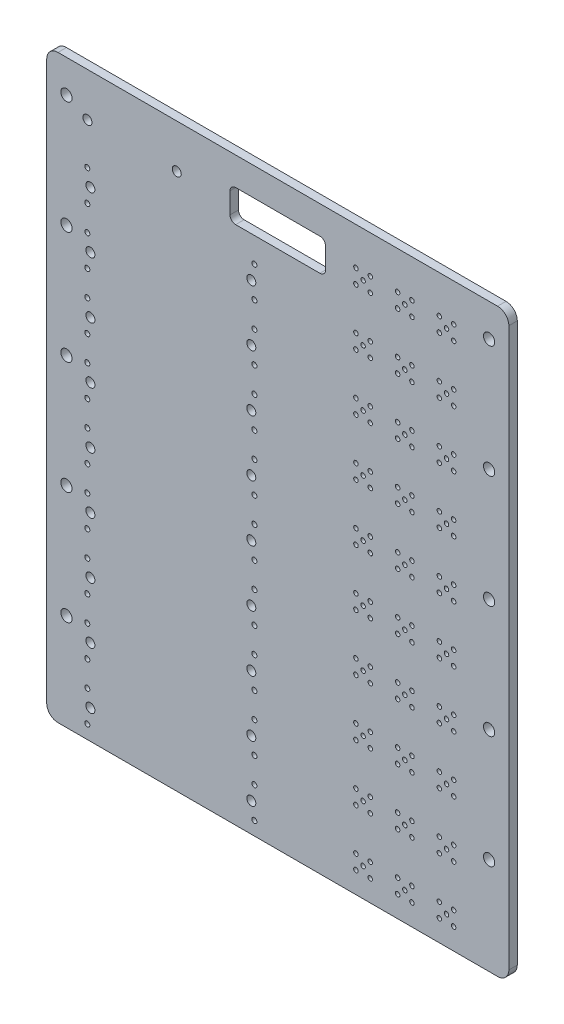
from build123d import *

# Parameters (mm, degrees)
SKETCH2_W                          = 82
SKETCH2_H                          = 103
MAINBOARD_DEPTH                    = 1.5
SKETCH3_W                          = 16.95
SKETCH3_H                          = 5.7
SOLARHOLE_DEPTH                    = 132.663396584
FILLET1_R                          = 2
FILLET2_R                          = 1
F_1_6MM_HOLE_20PIN_D               = 1.6
F_1_6MM_HOLE_20PIN_DEPTH           = 9.525
F_1_6MM_HOLE_20PIN_TIP             = 0.480688495
F_1_6MM_HOLE_40PN_BIG_AT_2_COUNT   = 2
F_1_6MM_HOLE_40PN_BIG_AT_2_PITCH   = 28.55
F_0_8MM_MMCX_HOLE_AT_2_COUNT       = 2
F_0_8MM_MMCX_HOLE_AT_2_PITCH       = 1.796051224
F_0_8MM_MMCX_HOLE_AT_3_COUNT       = 2
F_0_8MM_MMCX_HOLE_AT_3_PITCH       = 1.796051224
F_0_8MM_MMCX_HOLE_AT_4_COUNT       = 2
F_0_8MM_MMCX_HOLE_AT_4_PITCH       = 1.796051224
F_0_8MM_MMCX_HOLE_AT_5_COUNT       = 2
F_0_8MM_MMCX_HOLE_AT_5_PITCH       = 1.796051224
F_0_9MM_HOLE_40PIN_TINY_AT_2_COUNT = 2
F_0_9MM_HOLE_40PIN_TINY_AT_2_PITCH = 5.5
F_0_9MM_HOLE_40PIN_TINY_AT_3_COUNT = 2
F_0_9MM_HOLE_40PIN_TINY_AT_3_PITCH = 29.65
F_0_9MM_HOLE_40PIN_TINY_AT_4_COUNT = 2
F_0_9MM_HOLE_40PIN_TINY_AT_4_PITCH = 30.155803753
MMCX_INTRA_CARD_COUNT              = 3
MMCX_INTRA_CARD_PITCH              = 7.4
ZPOS_BLOCK_COUNT                   = 9
ZPOS_BLOCK_PITCH                   = 10
SCREWHOLES_INTRA_RAIL_COUNT        = 5
SCREWHOLES_INTRA_RAIL_PITCH        = 20


with BuildPart() as part:
    # Sketch2 → mainBoard (new body)
    with BuildSketch(Plane.XY):
        with Locations((41, 51.5)):
            Rectangle(SKETCH2_W, SKETCH2_H)
    extrude(amount=MAINBOARD_DEPTH)

    # Sketch3 → solarHole (cut, through all)
    with BuildSketch(Plane.XY.offset(1.5)):
        with Locations((41, 95.15)):
            Rectangle(SKETCH3_W, SKETCH3_H)
    extrude(amount=-SOLARHOLE_DEPTH, mode=Mode.SUBTRACT)

    # Fillet1
    fillet1_edges = [part.edges().sort_by_distance(p)[0] for p in [
        (0, 0, 0.75),
        (82, 0, 0.75),
        (82, 103, 0.75),
        (0, 103, 0.75),
    ]]
    fillet(fillet1_edges, radius=FILLET1_R)

    # Fillet2
    fillet2_edges = [part.edges().sort_by_distance(p)[0] for p in [
        (49.475, 92.3, 0.75),
        (49.475, 98, 0.75),
        (32.525, 92.3, 0.75),
        (32.525, 98, 0.75),
    ]]
    fillet(fillet2_edges, radius=FILLET2_R)

    # Sketch5 → Ø2.0mm Hole_screw (revolve, cut)
    with BuildSketch(Plane(origin=(3.5, 97.2, 1.5), x_dir=(0, -1, 0), z_dir=(1, 0, 0))):
        Polygon((0, 0), (0, 10.125860619), (1, 9.525), (1, 0), align=None)
    f_2_0mm_hole_screw = revolve(axis=Axis((3.5, 97.2, 7.85), (0, 0, -1)), mode=Mode.SUBTRACT)

    # Ø1.6mm Hole_20pin
    with Locations(Plane.XY.offset(1.5)):
        with Locations((7.225, 95.25), (23.075, 95.25)):
            Hole(F_1_6MM_HOLE_20PIN_D / 2, depth=F_1_6MM_HOLE_20PIN_DEPTH)
            with Locations((0, 0, -(F_1_6MM_HOLE_20PIN_DEPTH + F_1_6MM_HOLE_20PIN_TIP / 2))):  # 118° drill point
                Cone(0, F_1_6MM_HOLE_20PIN_D / 2, F_1_6MM_HOLE_20PIN_TIP, mode=Mode.SUBTRACT)

    # Sketch7 → Ø1.6mm Hole_40pn_big (revolve, cut)
    with BuildSketch(Plane(origin=(7.75, 85.15, 1.5), x_dir=(0, -1, 0), z_dir=(1, 0, 0))):
        Polygon((0, 0), (0, 10.005688495), (0.8, 9.525), (0.8, 0), align=None)
    f_1_6mm_hole_40pn_big = revolve(axis=Axis((7.75, 85.15, 7.85), (0, 0, -1)), mode=Mode.SUBTRACT)

    # Ø1.6mm Hole_40pn_big at 2: Ø1.6mm Hole_40pn_big ×2
    with Locations(*[(i * F_1_6MM_HOLE_40PN_BIG_AT_2_PITCH, 0, 0) for i in range(1, F_1_6MM_HOLE_40PN_BIG_AT_2_COUNT)]):
        add(f_1_6mm_hole_40pn_big, mode=Mode.SUBTRACT)

    # Sketch9 → Ø0.8mm MMCX Hole (revolve, cut)
    with BuildSketch(Plane(origin=(70.94, 85.05, 1.5), x_dir=(0, -1, 0), z_dir=(1, 0, 0))):
        Polygon((0, 0), (0, 9.765344248), (0.4, 9.525), (0.4, 0), align=None)
    f_0_8mm_mmcx_hole = revolve(axis=Axis((70.94, 85.05, 7.85), (0, 0, -1)), mode=Mode.SUBTRACT)

    # Ø0.8mm MMCX Hole at 2: Ø0.8mm MMCX Hole ×2
    with Locations(*[Vector(-0.7071067811865436, 0.7071067811865515, 0) * (i * F_0_8MM_MMCX_HOLE_AT_2_PITCH) for i in range(1, F_0_8MM_MMCX_HOLE_AT_2_COUNT)]):
        add(f_0_8mm_mmcx_hole, mode=Mode.SUBTRACT)

    # Ø0.8mm MMCX Hole at 3: Ø0.8mm MMCX Hole ×2
    with Locations(*[Vector(0.7071067811865476, 0.7071067811865476, 0) * (i * F_0_8MM_MMCX_HOLE_AT_3_PITCH) for i in range(1, F_0_8MM_MMCX_HOLE_AT_3_COUNT)]):
        add(f_0_8mm_mmcx_hole, mode=Mode.SUBTRACT)

    # Ø0.8mm MMCX Hole at 4: Ø0.8mm MMCX Hole ×2
    with Locations(*[Vector(0.7071067811865515, -0.7071067811865436, 0) * (i * F_0_8MM_MMCX_HOLE_AT_4_PITCH) for i in range(1, F_0_8MM_MMCX_HOLE_AT_4_COUNT)]):
        add(f_0_8mm_mmcx_hole, mode=Mode.SUBTRACT)

    # Ø0.8mm MMCX Hole at 5: Ø0.8mm MMCX Hole ×2
    with Locations(*[Vector(-0.7071067811865476, -0.7071067811865476, 0) * (i * F_0_8MM_MMCX_HOLE_AT_5_PITCH) for i in range(1, F_0_8MM_MMCX_HOLE_AT_5_COUNT)]):
        add(f_0_8mm_mmcx_hole, mode=Mode.SUBTRACT)

    # Sketch11 → Ø0.9mm Hole_40pin_tiny (revolve, cut)
    with BuildSketch(Plane(origin=(7.2, 87.9, 1.5), x_dir=(0, -1, 0), z_dir=(1, 0, 0))):
        Polygon((0, 0), (0, 9.795387279), (0.45, 9.525), (0.45, 0), align=None)
    f_0_9mm_hole_40pin_tiny = revolve(axis=Axis((7.2, 87.9, 7.85), (0, 0, -1)), mode=Mode.SUBTRACT)

    # Ø0.9mm Hole_40pin_tiny at 2: Ø0.9mm Hole_40pin_tiny ×2
    with Locations(*[(0, -i * F_0_9MM_HOLE_40PIN_TINY_AT_2_PITCH, 0) for i in range(1, F_0_9MM_HOLE_40PIN_TINY_AT_2_COUNT)]):
        add(f_0_9mm_hole_40pin_tiny, mode=Mode.SUBTRACT)

    # Ø0.9mm Hole_40pin_tiny at 3: Ø0.9mm Hole_40pin_tiny ×2
    with Locations(*[(i * F_0_9MM_HOLE_40PIN_TINY_AT_3_PITCH, 0, 0) for i in range(1, F_0_9MM_HOLE_40PIN_TINY_AT_3_COUNT)]):
        add(f_0_9mm_hole_40pin_tiny, mode=Mode.SUBTRACT)

    # Ø0.9mm Hole_40pin_tiny at 4: Ø0.9mm Hole_40pin_tiny ×2
    with Locations(*[Vector(0.9832269848512432, -0.18238611860646992, 0) * (i * F_0_9MM_HOLE_40PIN_TINY_AT_4_PITCH) for i in range(1, F_0_9MM_HOLE_40PIN_TINY_AT_4_COUNT)]):
        add(f_0_9mm_hole_40pin_tiny, mode=Mode.SUBTRACT)

    # MMCX_intra-card: Ø0.8mm MMCX Hole ×3
    with Locations(*[(-i * MMCX_INTRA_CARD_PITCH, 0, 0) for i in range(1, MMCX_INTRA_CARD_COUNT)]):
        add(f_0_8mm_mmcx_hole, mode=Mode.SUBTRACT)

    # MMCX_intra-card copy 1 sketch → MMCX_intra-card copy 1 (revolve, cut)
    with BuildSketch(Plane(origin=(62.27, 86.32, 1.5), x_dir=(0, -1, 0), z_dir=(1, 0, 0))):
        Polygon((0, 0), (0, 9.765344248), (0.4, 9.525), (0.4, 0), align=None)
    revolve(axis=Axis((62.27, 86.32, 7.85), (0, 0, -1)), mode=Mode.SUBTRACT)

    # MMCX_intra-card copy 2 sketch → MMCX_intra-card copy 2 (revolve, cut)
    with BuildSketch(Plane(origin=(54.87, 86.32, 1.5), x_dir=(0, -1, 0), z_dir=(1, 0, 0))):
        Polygon((0, 0), (0, 9.765344248), (0.4, 9.525), (0.4, 0), align=None)
    revolve(axis=Axis((54.87, 86.32, 7.85), (0, 0, -1)), mode=Mode.SUBTRACT)

    # MMCX_intra-card copy 3 sketch → MMCX_intra-card copy 3 (revolve, cut)
    with BuildSketch(Plane(origin=(64.81, 86.32, 1.5), x_dir=(0, -1, 0), z_dir=(1, 0, 0))):
        Polygon((0, 0), (0, 9.765344248), (0.4, 9.525), (0.4, 0), align=None)
    revolve(axis=Axis((64.81, 86.32, 7.85), (0, 0, -1)), mode=Mode.SUBTRACT)

    # MMCX_intra-card copy 4 sketch → MMCX_intra-card copy 4 (revolve, cut)
    with BuildSketch(Plane(origin=(57.41, 86.32, 1.5), x_dir=(0, -1, 0), z_dir=(1, 0, 0))):
        Polygon((0, 0), (0, 9.765344248), (0.4, 9.525), (0.4, 0), align=None)
    revolve(axis=Axis((57.41, 86.32, 7.85), (0, 0, -1)), mode=Mode.SUBTRACT)

    # MMCX_intra-card copy 5 sketch → MMCX_intra-card copy 5 (revolve, cut)
    with BuildSketch(Plane(origin=(64.81, 83.78, 1.5), x_dir=(0, -1, 0), z_dir=(1, 0, 0))):
        Polygon((0, 0), (0, 9.765344248), (0.4, 9.525), (0.4, 0), align=None)
    revolve(axis=Axis((64.81, 83.78, 7.85), (0, 0, -1)), mode=Mode.SUBTRACT)

    # MMCX_intra-card copy 6 sketch → MMCX_intra-card copy 6 (revolve, cut)
    with BuildSketch(Plane(origin=(57.41, 83.78, 1.5), x_dir=(0, -1, 0), z_dir=(1, 0, 0))):
        Polygon((0, 0), (0, 9.765344248), (0.4, 9.525), (0.4, 0), align=None)
    revolve(axis=Axis((57.41, 83.78, 7.85), (0, 0, -1)), mode=Mode.SUBTRACT)

    # MMCX_intra-card copy 7 sketch → MMCX_intra-card copy 7 (revolve, cut)
    with BuildSketch(Plane(origin=(62.27, 83.78, 1.5), x_dir=(0, -1, 0), z_dir=(1, 0, 0))):
        Polygon((0, 0), (0, 9.765344248), (0.4, 9.525), (0.4, 0), align=None)
    revolve(axis=Axis((62.27, 83.78, 7.85), (0, 0, -1)), mode=Mode.SUBTRACT)

    # MMCX_intra-card copy 8 sketch → MMCX_intra-card copy 8 (revolve, cut)
    with BuildSketch(Plane(origin=(54.87, 83.78, 1.5), x_dir=(0, -1, 0), z_dir=(1, 0, 0))):
        Polygon((0, 0), (0, 9.765344248), (0.4, 9.525), (0.4, 0), align=None)
    revolve(axis=Axis((54.87, 83.78, 7.85), (0, 0, -1)), mode=Mode.SUBTRACT)

    # Zpos_block: Ø1.6mm Hole_40pn_big, Ø0.9mm Hole_40pin_tiny ×9
    with Locations(*[(0, -i * ZPOS_BLOCK_PITCH, 0) for i in range(1, ZPOS_BLOCK_COUNT)]):
        add(f_1_6mm_hole_40pn_big, mode=Mode.SUBTRACT)
        add(f_0_9mm_hole_40pin_tiny, mode=Mode.SUBTRACT)

    # Zpos_block copy 1 sketch → Zpos_block copy 1 (revolve, cut)
    with BuildSketch(Plane(origin=(36.3, 75.15, 1.5), x_dir=(0, -1, 0), z_dir=(1, 0, 0))):
        Polygon((0, 0), (0, 10.005688495), (0.8, 9.525), (0.8, 0), align=None)
    revolve(axis=Axis((36.3, 75.15, 7.85), (0, 0, -1)), mode=Mode.SUBTRACT)

    # Zpos_block copy 2 sketch → Zpos_block copy 2 (revolve, cut)
    with BuildSketch(Plane(origin=(36.3, 65.15, 1.5), x_dir=(0, -1, 0), z_dir=(1, 0, 0))):
        Polygon((0, 0), (0, 10.005688495), (0.8, 9.525), (0.8, 0), align=None)
    revolve(axis=Axis((36.3, 65.15, 7.85), (0, 0, -1)), mode=Mode.SUBTRACT)

    # Zpos_block copy 3 sketch → Zpos_block copy 3 (revolve, cut)
    with BuildSketch(Plane(origin=(36.3, 55.15, 1.5), x_dir=(0, -1, 0), z_dir=(1, 0, 0))):
        Polygon((0, 0), (0, 10.005688495), (0.8, 9.525), (0.8, 0), align=None)
    revolve(axis=Axis((36.3, 55.15, 7.85), (0, 0, -1)), mode=Mode.SUBTRACT)

    # Zpos_block copy 4 sketch → Zpos_block copy 4 (revolve, cut)
    with BuildSketch(Plane(origin=(36.3, 45.15, 1.5), x_dir=(0, -1, 0), z_dir=(1, 0, 0))):
        Polygon((0, 0), (0, 10.005688495), (0.8, 9.525), (0.8, 0), align=None)
    revolve(axis=Axis((36.3, 45.15, 7.85), (0, 0, -1)), mode=Mode.SUBTRACT)

    # Zpos_block copy 5 sketch → Zpos_block copy 5 (revolve, cut)
    with BuildSketch(Plane(origin=(36.3, 35.15, 1.5), x_dir=(0, -1, 0), z_dir=(1, 0, 0))):
        Polygon((0, 0), (0, 10.005688495), (0.8, 9.525), (0.8, 0), align=None)
    revolve(axis=Axis((36.3, 35.15, 7.85), (0, 0, -1)), mode=Mode.SUBTRACT)

    # Zpos_block copy 6 sketch → Zpos_block copy 6 (revolve, cut)
    with BuildSketch(Plane(origin=(36.3, 25.15, 1.5), x_dir=(0, -1, 0), z_dir=(1, 0, 0))):
        Polygon((0, 0), (0, 10.005688495), (0.8, 9.525), (0.8, 0), align=None)
    revolve(axis=Axis((36.3, 25.15, 7.85), (0, 0, -1)), mode=Mode.SUBTRACT)

    # Zpos_block copy 7 sketch → Zpos_block copy 7 (revolve, cut)
    with BuildSketch(Plane(origin=(36.3, 15.15, 1.5), x_dir=(0, -1, 0), z_dir=(1, 0, 0))):
        Polygon((0, 0), (0, 10.005688495), (0.8, 9.525), (0.8, 0), align=None)
    revolve(axis=Axis((36.3, 15.15, 7.85), (0, 0, -1)), mode=Mode.SUBTRACT)

    # Zpos_block copy 8 sketch → Zpos_block copy 8 (revolve, cut)
    with BuildSketch(Plane(origin=(36.3, 5.15, 1.5), x_dir=(0, -1, 0), z_dir=(1, 0, 0))):
        Polygon((0, 0), (0, 10.005688495), (0.8, 9.525), (0.8, 0), align=None)
    revolve(axis=Axis((36.3, 5.15, 7.85), (0, 0, -1)), mode=Mode.SUBTRACT)

    # Zpos_block copy 9 sketch → Zpos_block copy 9 (revolve, cut)
    with BuildSketch(Plane(origin=(7.2, 72.4, 1.5), x_dir=(0, -1, 0), z_dir=(1, 0, 0))):
        Polygon((0, 0), (0, 9.795387279), (0.45, 9.525), (0.45, 0), align=None)
    revolve(axis=Axis((7.2, 72.4, 7.85), (0, 0, -1)), mode=Mode.SUBTRACT)

    # Zpos_block copy 10 sketch → Zpos_block copy 10 (revolve, cut)
    with BuildSketch(Plane(origin=(7.2, 62.4, 1.5), x_dir=(0, -1, 0), z_dir=(1, 0, 0))):
        Polygon((0, 0), (0, 9.795387279), (0.45, 9.525), (0.45, 0), align=None)
    revolve(axis=Axis((7.2, 62.4, 7.85), (0, 0, -1)), mode=Mode.SUBTRACT)

    # Zpos_block copy 11 sketch → Zpos_block copy 11 (revolve, cut)
    with BuildSketch(Plane(origin=(7.2, 52.4, 1.5), x_dir=(0, -1, 0), z_dir=(1, 0, 0))):
        Polygon((0, 0), (0, 9.795387279), (0.45, 9.525), (0.45, 0), align=None)
    revolve(axis=Axis((7.2, 52.4, 7.85), (0, 0, -1)), mode=Mode.SUBTRACT)

    # Zpos_block copy 12 sketch → Zpos_block copy 12 (revolve, cut)
    with BuildSketch(Plane(origin=(7.2, 42.4, 1.5), x_dir=(0, -1, 0), z_dir=(1, 0, 0))):
        Polygon((0, 0), (0, 9.795387279), (0.45, 9.525), (0.45, 0), align=None)
    revolve(axis=Axis((7.2, 42.4, 7.85), (0, 0, -1)), mode=Mode.SUBTRACT)

    # Zpos_block copy 13 sketch → Zpos_block copy 13 (revolve, cut)
    with BuildSketch(Plane(origin=(7.2, 32.4, 1.5), x_dir=(0, -1, 0), z_dir=(1, 0, 0))):
        Polygon((0, 0), (0, 9.795387279), (0.45, 9.525), (0.45, 0), align=None)
    revolve(axis=Axis((7.2, 32.4, 7.85), (0, 0, -1)), mode=Mode.SUBTRACT)

    # Zpos_block copy 14 sketch → Zpos_block copy 14 (revolve, cut)
    with BuildSketch(Plane(origin=(7.2, 22.4, 1.5), x_dir=(0, -1, 0), z_dir=(1, 0, 0))):
        Polygon((0, 0), (0, 9.795387279), (0.45, 9.525), (0.45, 0), align=None)
    revolve(axis=Axis((7.2, 22.4, 7.85), (0, 0, -1)), mode=Mode.SUBTRACT)

    # Zpos_block copy 15 sketch → Zpos_block copy 15 (revolve, cut)
    with BuildSketch(Plane(origin=(7.2, 12.4, 1.5), x_dir=(0, -1, 0), z_dir=(1, 0, 0))):
        Polygon((0, 0), (0, 9.795387279), (0.45, 9.525), (0.45, 0), align=None)
    revolve(axis=Axis((7.2, 12.4, 7.85), (0, 0, -1)), mode=Mode.SUBTRACT)

    # Zpos_block copy 16 sketch → Zpos_block copy 16 (revolve, cut)
    with BuildSketch(Plane(origin=(7.2, 2.4, 1.5), x_dir=(0, -1, 0), z_dir=(1, 0, 0))):
        Polygon((0, 0), (0, 9.795387279), (0.45, 9.525), (0.45, 0), align=None)
    revolve(axis=Axis((7.2, 2.4, 7.85), (0, 0, -1)), mode=Mode.SUBTRACT)

    # Zpos_block copy 17 sketch → Zpos_block copy 17 (revolve, cut)
    with BuildSketch(Plane(origin=(36.85, 77.9, 1.5), x_dir=(0, -1, 0), z_dir=(1, 0, 0))):
        Polygon((0, 0), (0, 9.795387279), (0.45, 9.525), (0.45, 0), align=None)
    revolve(axis=Axis((36.85, 77.9, 7.85), (0, 0, -1)), mode=Mode.SUBTRACT)

    # Zpos_block copy 18 sketch → Zpos_block copy 18 (revolve, cut)
    with BuildSketch(Plane(origin=(36.85, 67.9, 1.5), x_dir=(0, -1, 0), z_dir=(1, 0, 0))):
        Polygon((0, 0), (0, 9.795387279), (0.45, 9.525), (0.45, 0), align=None)
    revolve(axis=Axis((36.85, 67.9, 7.85), (0, 0, -1)), mode=Mode.SUBTRACT)

    # Zpos_block copy 19 sketch → Zpos_block copy 19 (revolve, cut)
    with BuildSketch(Plane(origin=(36.85, 57.9, 1.5), x_dir=(0, -1, 0), z_dir=(1, 0, 0))):
        Polygon((0, 0), (0, 9.795387279), (0.45, 9.525), (0.45, 0), align=None)
    revolve(axis=Axis((36.85, 57.9, 7.85), (0, 0, -1)), mode=Mode.SUBTRACT)

    # Zpos_block copy 20 sketch → Zpos_block copy 20 (revolve, cut)
    with BuildSketch(Plane(origin=(36.85, 47.9, 1.5), x_dir=(0, -1, 0), z_dir=(1, 0, 0))):
        Polygon((0, 0), (0, 9.795387279), (0.45, 9.525), (0.45, 0), align=None)
    revolve(axis=Axis((36.85, 47.9, 7.85), (0, 0, -1)), mode=Mode.SUBTRACT)

    # Zpos_block copy 21 sketch → Zpos_block copy 21 (revolve, cut)
    with BuildSketch(Plane(origin=(36.85, 37.9, 1.5), x_dir=(0, -1, 0), z_dir=(1, 0, 0))):
        Polygon((0, 0), (0, 9.795387279), (0.45, 9.525), (0.45, 0), align=None)
    revolve(axis=Axis((36.85, 37.9, 7.85), (0, 0, -1)), mode=Mode.SUBTRACT)

    # Zpos_block copy 22 sketch → Zpos_block copy 22 (revolve, cut)
    with BuildSketch(Plane(origin=(36.85, 27.9, 1.5), x_dir=(0, -1, 0), z_dir=(1, 0, 0))):
        Polygon((0, 0), (0, 9.795387279), (0.45, 9.525), (0.45, 0), align=None)
    revolve(axis=Axis((36.85, 27.9, 7.85), (0, 0, -1)), mode=Mode.SUBTRACT)

    # Zpos_block copy 23 sketch → Zpos_block copy 23 (revolve, cut)
    with BuildSketch(Plane(origin=(36.85, 17.9, 1.5), x_dir=(0, -1, 0), z_dir=(1, 0, 0))):
        Polygon((0, 0), (0, 9.795387279), (0.45, 9.525), (0.45, 0), align=None)
    revolve(axis=Axis((36.85, 17.9, 7.85), (0, 0, -1)), mode=Mode.SUBTRACT)

    # Zpos_block copy 24 sketch → Zpos_block copy 24 (revolve, cut)
    with BuildSketch(Plane(origin=(36.85, 7.9, 1.5), x_dir=(0, -1, 0), z_dir=(1, 0, 0))):
        Polygon((0, 0), (0, 9.795387279), (0.45, 9.525), (0.45, 0), align=None)
    revolve(axis=Axis((36.85, 7.9, 7.85), (0, 0, -1)), mode=Mode.SUBTRACT)

    # Zpos_block copy 25 sketch → Zpos_block copy 25 (revolve, cut)
    with BuildSketch(Plane(origin=(36.85, 72.4, 1.5), x_dir=(0, -1, 0), z_dir=(1, 0, 0))):
        Polygon((0, 0), (0, 9.795387279), (0.45, 9.525), (0.45, 0), align=None)
    revolve(axis=Axis((36.85, 72.4, 7.85), (0, 0, -1)), mode=Mode.SUBTRACT)

    # Zpos_block copy 26 sketch → Zpos_block copy 26 (revolve, cut)
    with BuildSketch(Plane(origin=(36.85, 62.4, 1.5), x_dir=(0, -1, 0), z_dir=(1, 0, 0))):
        Polygon((0, 0), (0, 9.795387279), (0.45, 9.525), (0.45, 0), align=None)
    revolve(axis=Axis((36.85, 62.4, 7.85), (0, 0, -1)), mode=Mode.SUBTRACT)

    # Zpos_block copy 27 sketch → Zpos_block copy 27 (revolve, cut)
    with BuildSketch(Plane(origin=(36.85, 52.4, 1.5), x_dir=(0, -1, 0), z_dir=(1, 0, 0))):
        Polygon((0, 0), (0, 9.795387279), (0.45, 9.525), (0.45, 0), align=None)
    revolve(axis=Axis((36.85, 52.4, 7.85), (0, 0, -1)), mode=Mode.SUBTRACT)

    # Zpos_block copy 28 sketch → Zpos_block copy 28 (revolve, cut)
    with BuildSketch(Plane(origin=(36.85, 42.4, 1.5), x_dir=(0, -1, 0), z_dir=(1, 0, 0))):
        Polygon((0, 0), (0, 9.795387279), (0.45, 9.525), (0.45, 0), align=None)
    revolve(axis=Axis((36.85, 42.4, 7.85), (0, 0, -1)), mode=Mode.SUBTRACT)

    # Zpos_block copy 29 sketch → Zpos_block copy 29 (revolve, cut)
    with BuildSketch(Plane(origin=(36.85, 32.4, 1.5), x_dir=(0, -1, 0), z_dir=(1, 0, 0))):
        Polygon((0, 0), (0, 9.795387279), (0.45, 9.525), (0.45, 0), align=None)
    revolve(axis=Axis((36.85, 32.4, 7.85), (0, 0, -1)), mode=Mode.SUBTRACT)

    # Zpos_block copy 30 sketch → Zpos_block copy 30 (revolve, cut)
    with BuildSketch(Plane(origin=(36.85, 22.4, 1.5), x_dir=(0, -1, 0), z_dir=(1, 0, 0))):
        Polygon((0, 0), (0, 9.795387279), (0.45, 9.525), (0.45, 0), align=None)
    revolve(axis=Axis((36.85, 22.4, 7.85), (0, 0, -1)), mode=Mode.SUBTRACT)

    # Zpos_block copy 31 sketch → Zpos_block copy 31 (revolve, cut)
    with BuildSketch(Plane(origin=(36.85, 12.4, 1.5), x_dir=(0, -1, 0), z_dir=(1, 0, 0))):
        Polygon((0, 0), (0, 9.795387279), (0.45, 9.525), (0.45, 0), align=None)
    revolve(axis=Axis((36.85, 12.4, 7.85), (0, 0, -1)), mode=Mode.SUBTRACT)

    # Zpos_block copy 32 sketch → Zpos_block copy 32 (revolve, cut)
    with BuildSketch(Plane(origin=(36.85, 2.4, 1.5), x_dir=(0, -1, 0), z_dir=(1, 0, 0))):
        Polygon((0, 0), (0, 9.795387279), (0.45, 9.525), (0.45, 0), align=None)
    revolve(axis=Axis((36.85, 2.4, 7.85), (0, 0, -1)), mode=Mode.SUBTRACT)

    # Zpos_block copy 33 sketch → Zpos_block copy 33 (revolve, cut)
    with BuildSketch(Plane(origin=(63.54, 75.05, 1.5), x_dir=(0, -1, 0), z_dir=(1, 0, 0))):
        Polygon((0, 0), (0, 9.765344248), (0.4, 9.525), (0.4, 0), align=None)
    revolve(axis=Axis((63.54, 75.05, 7.85), (0, 0, -1)), mode=Mode.SUBTRACT)

    # Zpos_block copy 34 sketch → Zpos_block copy 34 (revolve, cut)
    with BuildSketch(Plane(origin=(63.54, 65.05, 1.5), x_dir=(0, -1, 0), z_dir=(1, 0, 0))):
        Polygon((0, 0), (0, 9.765344248), (0.4, 9.525), (0.4, 0), align=None)
    revolve(axis=Axis((63.54, 65.05, 7.85), (0, 0, -1)), mode=Mode.SUBTRACT)

    # Zpos_block copy 35 sketch → Zpos_block copy 35 (revolve, cut)
    with BuildSketch(Plane(origin=(63.54, 55.05, 1.5), x_dir=(0, -1, 0), z_dir=(1, 0, 0))):
        Polygon((0, 0), (0, 9.765344248), (0.4, 9.525), (0.4, 0), align=None)
    revolve(axis=Axis((63.54, 55.05, 7.85), (0, 0, -1)), mode=Mode.SUBTRACT)

    # Zpos_block copy 36 sketch → Zpos_block copy 36 (revolve, cut)
    with BuildSketch(Plane(origin=(63.54, 45.05, 1.5), x_dir=(0, -1, 0), z_dir=(1, 0, 0))):
        Polygon((0, 0), (0, 9.765344248), (0.4, 9.525), (0.4, 0), align=None)
    revolve(axis=Axis((63.54, 45.05, 7.85), (0, 0, -1)), mode=Mode.SUBTRACT)

    # Zpos_block copy 37 sketch → Zpos_block copy 37 (revolve, cut)
    with BuildSketch(Plane(origin=(63.54, 35.05, 1.5), x_dir=(0, -1, 0), z_dir=(1, 0, 0))):
        Polygon((0, 0), (0, 9.765344248), (0.4, 9.525), (0.4, 0), align=None)
    revolve(axis=Axis((63.54, 35.05, 7.85), (0, 0, -1)), mode=Mode.SUBTRACT)

    # Zpos_block copy 38 sketch → Zpos_block copy 38 (revolve, cut)
    with BuildSketch(Plane(origin=(63.54, 25.05, 1.5), x_dir=(0, -1, 0), z_dir=(1, 0, 0))):
        Polygon((0, 0), (0, 9.765344248), (0.4, 9.525), (0.4, 0), align=None)
    revolve(axis=Axis((63.54, 25.05, 7.85), (0, 0, -1)), mode=Mode.SUBTRACT)

    # Zpos_block copy 39 sketch → Zpos_block copy 39 (revolve, cut)
    with BuildSketch(Plane(origin=(63.54, 15.05, 1.5), x_dir=(0, -1, 0), z_dir=(1, 0, 0))):
        Polygon((0, 0), (0, 9.765344248), (0.4, 9.525), (0.4, 0), align=None)
    revolve(axis=Axis((63.54, 15.05, 7.85), (0, 0, -1)), mode=Mode.SUBTRACT)

    # Zpos_block copy 40 sketch → Zpos_block copy 40 (revolve, cut)
    with BuildSketch(Plane(origin=(63.54, 5.05, 1.5), x_dir=(0, -1, 0), z_dir=(1, 0, 0))):
        Polygon((0, 0), (0, 9.765344248), (0.4, 9.525), (0.4, 0), align=None)
    revolve(axis=Axis((63.54, 5.05, 7.85), (0, 0, -1)), mode=Mode.SUBTRACT)

    # Zpos_block copy 41 sketch → Zpos_block copy 41 (revolve, cut)
    with BuildSketch(Plane(origin=(56.14, 75.05, 1.5), x_dir=(0, -1, 0), z_dir=(1, 0, 0))):
        Polygon((0, 0), (0, 9.765344248), (0.4, 9.525), (0.4, 0), align=None)
    revolve(axis=Axis((56.14, 75.05, 7.85), (0, 0, -1)), mode=Mode.SUBTRACT)

    # Zpos_block copy 42 sketch → Zpos_block copy 42 (revolve, cut)
    with BuildSketch(Plane(origin=(56.14, 65.05, 1.5), x_dir=(0, -1, 0), z_dir=(1, 0, 0))):
        Polygon((0, 0), (0, 9.765344248), (0.4, 9.525), (0.4, 0), align=None)
    revolve(axis=Axis((56.14, 65.05, 7.85), (0, 0, -1)), mode=Mode.SUBTRACT)

    # Zpos_block copy 43 sketch → Zpos_block copy 43 (revolve, cut)
    with BuildSketch(Plane(origin=(56.14, 55.05, 1.5), x_dir=(0, -1, 0), z_dir=(1, 0, 0))):
        Polygon((0, 0), (0, 9.765344248), (0.4, 9.525), (0.4, 0), align=None)
    revolve(axis=Axis((56.14, 55.05, 7.85), (0, 0, -1)), mode=Mode.SUBTRACT)

    # Zpos_block copy 44 sketch → Zpos_block copy 44 (revolve, cut)
    with BuildSketch(Plane(origin=(56.14, 45.05, 1.5), x_dir=(0, -1, 0), z_dir=(1, 0, 0))):
        Polygon((0, 0), (0, 9.765344248), (0.4, 9.525), (0.4, 0), align=None)
    revolve(axis=Axis((56.14, 45.05, 7.85), (0, 0, -1)), mode=Mode.SUBTRACT)

    # Zpos_block copy 45 sketch → Zpos_block copy 45 (revolve, cut)
    with BuildSketch(Plane(origin=(56.14, 35.05, 1.5), x_dir=(0, -1, 0), z_dir=(1, 0, 0))):
        Polygon((0, 0), (0, 9.765344248), (0.4, 9.525), (0.4, 0), align=None)
    revolve(axis=Axis((56.14, 35.05, 7.85), (0, 0, -1)), mode=Mode.SUBTRACT)

    # Zpos_block copy 46 sketch → Zpos_block copy 46 (revolve, cut)
    with BuildSketch(Plane(origin=(56.14, 25.05, 1.5), x_dir=(0, -1, 0), z_dir=(1, 0, 0))):
        Polygon((0, 0), (0, 9.765344248), (0.4, 9.525), (0.4, 0), align=None)
    revolve(axis=Axis((56.14, 25.05, 7.85), (0, 0, -1)), mode=Mode.SUBTRACT)

    # Zpos_block copy 47 sketch → Zpos_block copy 47 (revolve, cut)
    with BuildSketch(Plane(origin=(56.14, 15.05, 1.5), x_dir=(0, -1, 0), z_dir=(1, 0, 0))):
        Polygon((0, 0), (0, 9.765344248), (0.4, 9.525), (0.4, 0), align=None)
    revolve(axis=Axis((56.14, 15.05, 7.85), (0, 0, -1)), mode=Mode.SUBTRACT)

    # Zpos_block copy 48 sketch → Zpos_block copy 48 (revolve, cut)
    with BuildSketch(Plane(origin=(56.14, 5.05, 1.5), x_dir=(0, -1, 0), z_dir=(1, 0, 0))):
        Polygon((0, 0), (0, 9.765344248), (0.4, 9.525), (0.4, 0), align=None)
    revolve(axis=Axis((56.14, 5.05, 7.85), (0, 0, -1)), mode=Mode.SUBTRACT)

    # Zpos_block copy 49 sketch → Zpos_block copy 49 (revolve, cut)
    with BuildSketch(Plane(origin=(62.27, 76.32, 1.5), x_dir=(0, -1, 0), z_dir=(1, 0, 0))):
        Polygon((0, 0), (0, 9.765344248), (0.4, 9.525), (0.4, 0), align=None)
    revolve(axis=Axis((62.27, 76.32, 7.85), (0, 0, -1)), mode=Mode.SUBTRACT)

    # Zpos_block copy 50 sketch → Zpos_block copy 50 (revolve, cut)
    with BuildSketch(Plane(origin=(62.27, 66.32, 1.5), x_dir=(0, -1, 0), z_dir=(1, 0, 0))):
        Polygon((0, 0), (0, 9.765344248), (0.4, 9.525), (0.4, 0), align=None)
    revolve(axis=Axis((62.27, 66.32, 7.85), (0, 0, -1)), mode=Mode.SUBTRACT)

    # Zpos_block copy 51 sketch → Zpos_block copy 51 (revolve, cut)
    with BuildSketch(Plane(origin=(62.27, 56.32, 1.5), x_dir=(0, -1, 0), z_dir=(1, 0, 0))):
        Polygon((0, 0), (0, 9.765344248), (0.4, 9.525), (0.4, 0), align=None)
    revolve(axis=Axis((62.27, 56.32, 7.85), (0, 0, -1)), mode=Mode.SUBTRACT)

    # Zpos_block copy 52 sketch → Zpos_block copy 52 (revolve, cut)
    with BuildSketch(Plane(origin=(62.27, 46.32, 1.5), x_dir=(0, -1, 0), z_dir=(1, 0, 0))):
        Polygon((0, 0), (0, 9.765344248), (0.4, 9.525), (0.4, 0), align=None)
    revolve(axis=Axis((62.27, 46.32, 7.85), (0, 0, -1)), mode=Mode.SUBTRACT)

    # Zpos_block copy 53 sketch → Zpos_block copy 53 (revolve, cut)
    with BuildSketch(Plane(origin=(62.27, 36.32, 1.5), x_dir=(0, -1, 0), z_dir=(1, 0, 0))):
        Polygon((0, 0), (0, 9.765344248), (0.4, 9.525), (0.4, 0), align=None)
    revolve(axis=Axis((62.27, 36.32, 7.85), (0, 0, -1)), mode=Mode.SUBTRACT)

    # Zpos_block copy 54 sketch → Zpos_block copy 54 (revolve, cut)
    with BuildSketch(Plane(origin=(62.27, 26.32, 1.5), x_dir=(0, -1, 0), z_dir=(1, 0, 0))):
        Polygon((0, 0), (0, 9.765344248), (0.4, 9.525), (0.4, 0), align=None)
    revolve(axis=Axis((62.27, 26.32, 7.85), (0, 0, -1)), mode=Mode.SUBTRACT)

    # Zpos_block copy 55 sketch → Zpos_block copy 55 (revolve, cut)
    with BuildSketch(Plane(origin=(62.27, 16.32, 1.5), x_dir=(0, -1, 0), z_dir=(1, 0, 0))):
        Polygon((0, 0), (0, 9.765344248), (0.4, 9.525), (0.4, 0), align=None)
    revolve(axis=Axis((62.27, 16.32, 7.85), (0, 0, -1)), mode=Mode.SUBTRACT)

    # Zpos_block copy 56 sketch → Zpos_block copy 56 (revolve, cut)
    with BuildSketch(Plane(origin=(62.27, 6.32, 1.5), x_dir=(0, -1, 0), z_dir=(1, 0, 0))):
        Polygon((0, 0), (0, 9.765344248), (0.4, 9.525), (0.4, 0), align=None)
    revolve(axis=Axis((62.27, 6.32, 7.85), (0, 0, -1)), mode=Mode.SUBTRACT)

    # Zpos_block copy 57 sketch → Zpos_block copy 57 (revolve, cut)
    with BuildSketch(Plane(origin=(54.87, 76.32, 1.5), x_dir=(0, -1, 0), z_dir=(1, 0, 0))):
        Polygon((0, 0), (0, 9.765344248), (0.4, 9.525), (0.4, 0), align=None)
    revolve(axis=Axis((54.87, 76.32, 7.85), (0, 0, -1)), mode=Mode.SUBTRACT)

    # Zpos_block copy 58 sketch → Zpos_block copy 58 (revolve, cut)
    with BuildSketch(Plane(origin=(54.87, 66.32, 1.5), x_dir=(0, -1, 0), z_dir=(1, 0, 0))):
        Polygon((0, 0), (0, 9.765344248), (0.4, 9.525), (0.4, 0), align=None)
    revolve(axis=Axis((54.87, 66.32, 7.85), (0, 0, -1)), mode=Mode.SUBTRACT)

    # Zpos_block copy 59 sketch → Zpos_block copy 59 (revolve, cut)
    with BuildSketch(Plane(origin=(54.87, 56.32, 1.5), x_dir=(0, -1, 0), z_dir=(1, 0, 0))):
        Polygon((0, 0), (0, 9.765344248), (0.4, 9.525), (0.4, 0), align=None)
    revolve(axis=Axis((54.87, 56.32, 7.85), (0, 0, -1)), mode=Mode.SUBTRACT)

    # Zpos_block copy 60 sketch → Zpos_block copy 60 (revolve, cut)
    with BuildSketch(Plane(origin=(54.87, 46.32, 1.5), x_dir=(0, -1, 0), z_dir=(1, 0, 0))):
        Polygon((0, 0), (0, 9.765344248), (0.4, 9.525), (0.4, 0), align=None)
    revolve(axis=Axis((54.87, 46.32, 7.85), (0, 0, -1)), mode=Mode.SUBTRACT)

    # Zpos_block copy 61 sketch → Zpos_block copy 61 (revolve, cut)
    with BuildSketch(Plane(origin=(54.87, 36.32, 1.5), x_dir=(0, -1, 0), z_dir=(1, 0, 0))):
        Polygon((0, 0), (0, 9.765344248), (0.4, 9.525), (0.4, 0), align=None)
    revolve(axis=Axis((54.87, 36.32, 7.85), (0, 0, -1)), mode=Mode.SUBTRACT)

    # Zpos_block copy 62 sketch → Zpos_block copy 62 (revolve, cut)
    with BuildSketch(Plane(origin=(54.87, 26.32, 1.5), x_dir=(0, -1, 0), z_dir=(1, 0, 0))):
        Polygon((0, 0), (0, 9.765344248), (0.4, 9.525), (0.4, 0), align=None)
    revolve(axis=Axis((54.87, 26.32, 7.85), (0, 0, -1)), mode=Mode.SUBTRACT)

    # Zpos_block copy 63 sketch → Zpos_block copy 63 (revolve, cut)
    with BuildSketch(Plane(origin=(54.87, 16.32, 1.5), x_dir=(0, -1, 0), z_dir=(1, 0, 0))):
        Polygon((0, 0), (0, 9.765344248), (0.4, 9.525), (0.4, 0), align=None)
    revolve(axis=Axis((54.87, 16.32, 7.85), (0, 0, -1)), mode=Mode.SUBTRACT)

    # Zpos_block copy 64 sketch → Zpos_block copy 64 (revolve, cut)
    with BuildSketch(Plane(origin=(54.87, 6.32, 1.5), x_dir=(0, -1, 0), z_dir=(1, 0, 0))):
        Polygon((0, 0), (0, 9.765344248), (0.4, 9.525), (0.4, 0), align=None)
    revolve(axis=Axis((54.87, 6.32, 7.85), (0, 0, -1)), mode=Mode.SUBTRACT)

    # Zpos_block copy 65 sketch → Zpos_block copy 65 (revolve, cut)
    with BuildSketch(Plane(origin=(64.81, 76.32, 1.5), x_dir=(0, -1, 0), z_dir=(1, 0, 0))):
        Polygon((0, 0), (0, 9.765344248), (0.4, 9.525), (0.4, 0), align=None)
    revolve(axis=Axis((64.81, 76.32, 7.85), (0, 0, -1)), mode=Mode.SUBTRACT)

    # Zpos_block copy 66 sketch → Zpos_block copy 66 (revolve, cut)
    with BuildSketch(Plane(origin=(64.81, 66.32, 1.5), x_dir=(0, -1, 0), z_dir=(1, 0, 0))):
        Polygon((0, 0), (0, 9.765344248), (0.4, 9.525), (0.4, 0), align=None)
    revolve(axis=Axis((64.81, 66.32, 7.85), (0, 0, -1)), mode=Mode.SUBTRACT)

    # Zpos_block copy 67 sketch → Zpos_block copy 67 (revolve, cut)
    with BuildSketch(Plane(origin=(64.81, 56.32, 1.5), x_dir=(0, -1, 0), z_dir=(1, 0, 0))):
        Polygon((0, 0), (0, 9.765344248), (0.4, 9.525), (0.4, 0), align=None)
    revolve(axis=Axis((64.81, 56.32, 7.85), (0, 0, -1)), mode=Mode.SUBTRACT)

    # Zpos_block copy 68 sketch → Zpos_block copy 68 (revolve, cut)
    with BuildSketch(Plane(origin=(64.81, 46.32, 1.5), x_dir=(0, -1, 0), z_dir=(1, 0, 0))):
        Polygon((0, 0), (0, 9.765344248), (0.4, 9.525), (0.4, 0), align=None)
    revolve(axis=Axis((64.81, 46.32, 7.85), (0, 0, -1)), mode=Mode.SUBTRACT)

    # Zpos_block copy 69 sketch → Zpos_block copy 69 (revolve, cut)
    with BuildSketch(Plane(origin=(64.81, 36.32, 1.5), x_dir=(0, -1, 0), z_dir=(1, 0, 0))):
        Polygon((0, 0), (0, 9.765344248), (0.4, 9.525), (0.4, 0), align=None)
    revolve(axis=Axis((64.81, 36.32, 7.85), (0, 0, -1)), mode=Mode.SUBTRACT)

    # Zpos_block copy 70 sketch → Zpos_block copy 70 (revolve, cut)
    with BuildSketch(Plane(origin=(64.81, 26.32, 1.5), x_dir=(0, -1, 0), z_dir=(1, 0, 0))):
        Polygon((0, 0), (0, 9.765344248), (0.4, 9.525), (0.4, 0), align=None)
    revolve(axis=Axis((64.81, 26.32, 7.85), (0, 0, -1)), mode=Mode.SUBTRACT)

    # Zpos_block copy 71 sketch → Zpos_block copy 71 (revolve, cut)
    with BuildSketch(Plane(origin=(64.81, 16.32, 1.5), x_dir=(0, -1, 0), z_dir=(1, 0, 0))):
        Polygon((0, 0), (0, 9.765344248), (0.4, 9.525), (0.4, 0), align=None)
    revolve(axis=Axis((64.81, 16.32, 7.85), (0, 0, -1)), mode=Mode.SUBTRACT)

    # Zpos_block copy 72 sketch → Zpos_block copy 72 (revolve, cut)
    with BuildSketch(Plane(origin=(64.81, 6.32, 1.5), x_dir=(0, -1, 0), z_dir=(1, 0, 0))):
        Polygon((0, 0), (0, 9.765344248), (0.4, 9.525), (0.4, 0), align=None)
    revolve(axis=Axis((64.81, 6.32, 7.85), (0, 0, -1)), mode=Mode.SUBTRACT)

    # Zpos_block copy 73 sketch → Zpos_block copy 73 (revolve, cut)
    with BuildSketch(Plane(origin=(57.41, 76.32, 1.5), x_dir=(0, -1, 0), z_dir=(1, 0, 0))):
        Polygon((0, 0), (0, 9.765344248), (0.4, 9.525), (0.4, 0), align=None)
    revolve(axis=Axis((57.41, 76.32, 7.85), (0, 0, -1)), mode=Mode.SUBTRACT)

    # Zpos_block copy 74 sketch → Zpos_block copy 74 (revolve, cut)
    with BuildSketch(Plane(origin=(57.41, 66.32, 1.5), x_dir=(0, -1, 0), z_dir=(1, 0, 0))):
        Polygon((0, 0), (0, 9.765344248), (0.4, 9.525), (0.4, 0), align=None)
    revolve(axis=Axis((57.41, 66.32, 7.85), (0, 0, -1)), mode=Mode.SUBTRACT)

    # Zpos_block copy 75 sketch → Zpos_block copy 75 (revolve, cut)
    with BuildSketch(Plane(origin=(57.41, 56.32, 1.5), x_dir=(0, -1, 0), z_dir=(1, 0, 0))):
        Polygon((0, 0), (0, 9.765344248), (0.4, 9.525), (0.4, 0), align=None)
    revolve(axis=Axis((57.41, 56.32, 7.85), (0, 0, -1)), mode=Mode.SUBTRACT)

    # Zpos_block copy 76 sketch → Zpos_block copy 76 (revolve, cut)
    with BuildSketch(Plane(origin=(57.41, 46.32, 1.5), x_dir=(0, -1, 0), z_dir=(1, 0, 0))):
        Polygon((0, 0), (0, 9.765344248), (0.4, 9.525), (0.4, 0), align=None)
    revolve(axis=Axis((57.41, 46.32, 7.85), (0, 0, -1)), mode=Mode.SUBTRACT)

    # Zpos_block copy 77 sketch → Zpos_block copy 77 (revolve, cut)
    with BuildSketch(Plane(origin=(57.41, 36.32, 1.5), x_dir=(0, -1, 0), z_dir=(1, 0, 0))):
        Polygon((0, 0), (0, 9.765344248), (0.4, 9.525), (0.4, 0), align=None)
    revolve(axis=Axis((57.41, 36.32, 7.85), (0, 0, -1)), mode=Mode.SUBTRACT)

    # Zpos_block copy 78 sketch → Zpos_block copy 78 (revolve, cut)
    with BuildSketch(Plane(origin=(57.41, 26.32, 1.5), x_dir=(0, -1, 0), z_dir=(1, 0, 0))):
        Polygon((0, 0), (0, 9.765344248), (0.4, 9.525), (0.4, 0), align=None)
    revolve(axis=Axis((57.41, 26.32, 7.85), (0, 0, -1)), mode=Mode.SUBTRACT)

    # Zpos_block copy 79 sketch → Zpos_block copy 79 (revolve, cut)
    with BuildSketch(Plane(origin=(57.41, 16.32, 1.5), x_dir=(0, -1, 0), z_dir=(1, 0, 0))):
        Polygon((0, 0), (0, 9.765344248), (0.4, 9.525), (0.4, 0), align=None)
    revolve(axis=Axis((57.41, 16.32, 7.85), (0, 0, -1)), mode=Mode.SUBTRACT)

    # Zpos_block copy 80 sketch → Zpos_block copy 80 (revolve, cut)
    with BuildSketch(Plane(origin=(57.41, 6.32, 1.5), x_dir=(0, -1, 0), z_dir=(1, 0, 0))):
        Polygon((0, 0), (0, 9.765344248), (0.4, 9.525), (0.4, 0), align=None)
    revolve(axis=Axis((57.41, 6.32, 7.85), (0, 0, -1)), mode=Mode.SUBTRACT)

    # Zpos_block copy 81 sketch → Zpos_block copy 81 (revolve, cut)
    with BuildSketch(Plane(origin=(64.81, 73.78, 1.5), x_dir=(0, -1, 0), z_dir=(1, 0, 0))):
        Polygon((0, 0), (0, 9.765344248), (0.4, 9.525), (0.4, 0), align=None)
    revolve(axis=Axis((64.81, 73.78, 7.85), (0, 0, -1)), mode=Mode.SUBTRACT)

    # Zpos_block copy 82 sketch → Zpos_block copy 82 (revolve, cut)
    with BuildSketch(Plane(origin=(64.81, 63.78, 1.5), x_dir=(0, -1, 0), z_dir=(1, 0, 0))):
        Polygon((0, 0), (0, 9.765344248), (0.4, 9.525), (0.4, 0), align=None)
    revolve(axis=Axis((64.81, 63.78, 7.85), (0, 0, -1)), mode=Mode.SUBTRACT)

    # Zpos_block copy 83 sketch → Zpos_block copy 83 (revolve, cut)
    with BuildSketch(Plane(origin=(64.81, 53.78, 1.5), x_dir=(0, -1, 0), z_dir=(1, 0, 0))):
        Polygon((0, 0), (0, 9.765344248), (0.4, 9.525), (0.4, 0), align=None)
    revolve(axis=Axis((64.81, 53.78, 7.85), (0, 0, -1)), mode=Mode.SUBTRACT)

    # Zpos_block copy 84 sketch → Zpos_block copy 84 (revolve, cut)
    with BuildSketch(Plane(origin=(64.81, 43.78, 1.5), x_dir=(0, -1, 0), z_dir=(1, 0, 0))):
        Polygon((0, 0), (0, 9.765344248), (0.4, 9.525), (0.4, 0), align=None)
    revolve(axis=Axis((64.81, 43.78, 7.85), (0, 0, -1)), mode=Mode.SUBTRACT)

    # Zpos_block copy 85 sketch → Zpos_block copy 85 (revolve, cut)
    with BuildSketch(Plane(origin=(64.81, 33.78, 1.5), x_dir=(0, -1, 0), z_dir=(1, 0, 0))):
        Polygon((0, 0), (0, 9.765344248), (0.4, 9.525), (0.4, 0), align=None)
    revolve(axis=Axis((64.81, 33.78, 7.85), (0, 0, -1)), mode=Mode.SUBTRACT)

    # Zpos_block copy 86 sketch → Zpos_block copy 86 (revolve, cut)
    with BuildSketch(Plane(origin=(64.81, 23.78, 1.5), x_dir=(0, -1, 0), z_dir=(1, 0, 0))):
        Polygon((0, 0), (0, 9.765344248), (0.4, 9.525), (0.4, 0), align=None)
    revolve(axis=Axis((64.81, 23.78, 7.85), (0, 0, -1)), mode=Mode.SUBTRACT)

    # Zpos_block copy 87 sketch → Zpos_block copy 87 (revolve, cut)
    with BuildSketch(Plane(origin=(64.81, 13.78, 1.5), x_dir=(0, -1, 0), z_dir=(1, 0, 0))):
        Polygon((0, 0), (0, 9.765344248), (0.4, 9.525), (0.4, 0), align=None)
    revolve(axis=Axis((64.81, 13.78, 7.85), (0, 0, -1)), mode=Mode.SUBTRACT)

    # Zpos_block copy 88 sketch → Zpos_block copy 88 (revolve, cut)
    with BuildSketch(Plane(origin=(64.81, 3.78, 1.5), x_dir=(0, -1, 0), z_dir=(1, 0, 0))):
        Polygon((0, 0), (0, 9.765344248), (0.4, 9.525), (0.4, 0), align=None)
    revolve(axis=Axis((64.81, 3.78, 7.85), (0, 0, -1)), mode=Mode.SUBTRACT)

    # Zpos_block copy 89 sketch → Zpos_block copy 89 (revolve, cut)
    with BuildSketch(Plane(origin=(57.41, 73.78, 1.5), x_dir=(0, -1, 0), z_dir=(1, 0, 0))):
        Polygon((0, 0), (0, 9.765344248), (0.4, 9.525), (0.4, 0), align=None)
    revolve(axis=Axis((57.41, 73.78, 7.85), (0, 0, -1)), mode=Mode.SUBTRACT)

    # Zpos_block copy 90 sketch → Zpos_block copy 90 (revolve, cut)
    with BuildSketch(Plane(origin=(57.41, 63.78, 1.5), x_dir=(0, -1, 0), z_dir=(1, 0, 0))):
        Polygon((0, 0), (0, 9.765344248), (0.4, 9.525), (0.4, 0), align=None)
    revolve(axis=Axis((57.41, 63.78, 7.85), (0, 0, -1)), mode=Mode.SUBTRACT)

    # Zpos_block copy 91 sketch → Zpos_block copy 91 (revolve, cut)
    with BuildSketch(Plane(origin=(57.41, 53.78, 1.5), x_dir=(0, -1, 0), z_dir=(1, 0, 0))):
        Polygon((0, 0), (0, 9.765344248), (0.4, 9.525), (0.4, 0), align=None)
    revolve(axis=Axis((57.41, 53.78, 7.85), (0, 0, -1)), mode=Mode.SUBTRACT)

    # Zpos_block copy 92 sketch → Zpos_block copy 92 (revolve, cut)
    with BuildSketch(Plane(origin=(57.41, 43.78, 1.5), x_dir=(0, -1, 0), z_dir=(1, 0, 0))):
        Polygon((0, 0), (0, 9.765344248), (0.4, 9.525), (0.4, 0), align=None)
    revolve(axis=Axis((57.41, 43.78, 7.85), (0, 0, -1)), mode=Mode.SUBTRACT)

    # Zpos_block copy 93 sketch → Zpos_block copy 93 (revolve, cut)
    with BuildSketch(Plane(origin=(57.41, 33.78, 1.5), x_dir=(0, -1, 0), z_dir=(1, 0, 0))):
        Polygon((0, 0), (0, 9.765344248), (0.4, 9.525), (0.4, 0), align=None)
    revolve(axis=Axis((57.41, 33.78, 7.85), (0, 0, -1)), mode=Mode.SUBTRACT)

    # Zpos_block copy 94 sketch → Zpos_block copy 94 (revolve, cut)
    with BuildSketch(Plane(origin=(57.41, 23.78, 1.5), x_dir=(0, -1, 0), z_dir=(1, 0, 0))):
        Polygon((0, 0), (0, 9.765344248), (0.4, 9.525), (0.4, 0), align=None)
    revolve(axis=Axis((57.41, 23.78, 7.85), (0, 0, -1)), mode=Mode.SUBTRACT)

    # Zpos_block copy 95 sketch → Zpos_block copy 95 (revolve, cut)
    with BuildSketch(Plane(origin=(57.41, 13.78, 1.5), x_dir=(0, -1, 0), z_dir=(1, 0, 0))):
        Polygon((0, 0), (0, 9.765344248), (0.4, 9.525), (0.4, 0), align=None)
    revolve(axis=Axis((57.41, 13.78, 7.85), (0, 0, -1)), mode=Mode.SUBTRACT)

    # Zpos_block copy 96 sketch → Zpos_block copy 96 (revolve, cut)
    with BuildSketch(Plane(origin=(57.41, 3.78, 1.5), x_dir=(0, -1, 0), z_dir=(1, 0, 0))):
        Polygon((0, 0), (0, 9.765344248), (0.4, 9.525), (0.4, 0), align=None)
    revolve(axis=Axis((57.41, 3.78, 7.85), (0, 0, -1)), mode=Mode.SUBTRACT)

    # Zpos_block copy 97 sketch → Zpos_block copy 97 (revolve, cut)
    with BuildSketch(Plane(origin=(62.27, 73.78, 1.5), x_dir=(0, -1, 0), z_dir=(1, 0, 0))):
        Polygon((0, 0), (0, 9.765344248), (0.4, 9.525), (0.4, 0), align=None)
    revolve(axis=Axis((62.27, 73.78, 7.85), (0, 0, -1)), mode=Mode.SUBTRACT)

    # Zpos_block copy 98 sketch → Zpos_block copy 98 (revolve, cut)
    with BuildSketch(Plane(origin=(62.27, 63.78, 1.5), x_dir=(0, -1, 0), z_dir=(1, 0, 0))):
        Polygon((0, 0), (0, 9.765344248), (0.4, 9.525), (0.4, 0), align=None)
    revolve(axis=Axis((62.27, 63.78, 7.85), (0, 0, -1)), mode=Mode.SUBTRACT)

    # Zpos_block copy 99 sketch → Zpos_block copy 99 (revolve, cut)
    with BuildSketch(Plane(origin=(62.27, 53.78, 1.5), x_dir=(0, -1, 0), z_dir=(1, 0, 0))):
        Polygon((0, 0), (0, 9.765344248), (0.4, 9.525), (0.4, 0), align=None)
    revolve(axis=Axis((62.27, 53.78, 7.85), (0, 0, -1)), mode=Mode.SUBTRACT)

    # Zpos_block copy 100 sketch → Zpos_block copy 100 (revolve, cut)
    with BuildSketch(Plane(origin=(62.27, 43.78, 1.5), x_dir=(0, -1, 0), z_dir=(1, 0, 0))):
        Polygon((0, 0), (0, 9.765344248), (0.4, 9.525), (0.4, 0), align=None)
    revolve(axis=Axis((62.27, 43.78, 7.85), (0, 0, -1)), mode=Mode.SUBTRACT)

    # Zpos_block copy 101 sketch → Zpos_block copy 101 (revolve, cut)
    with BuildSketch(Plane(origin=(62.27, 33.78, 1.5), x_dir=(0, -1, 0), z_dir=(1, 0, 0))):
        Polygon((0, 0), (0, 9.765344248), (0.4, 9.525), (0.4, 0), align=None)
    revolve(axis=Axis((62.27, 33.78, 7.85), (0, 0, -1)), mode=Mode.SUBTRACT)

    # Zpos_block copy 102 sketch → Zpos_block copy 102 (revolve, cut)
    with BuildSketch(Plane(origin=(62.27, 23.78, 1.5), x_dir=(0, -1, 0), z_dir=(1, 0, 0))):
        Polygon((0, 0), (0, 9.765344248), (0.4, 9.525), (0.4, 0), align=None)
    revolve(axis=Axis((62.27, 23.78, 7.85), (0, 0, -1)), mode=Mode.SUBTRACT)

    # Zpos_block copy 103 sketch → Zpos_block copy 103 (revolve, cut)
    with BuildSketch(Plane(origin=(62.27, 13.78, 1.5), x_dir=(0, -1, 0), z_dir=(1, 0, 0))):
        Polygon((0, 0), (0, 9.765344248), (0.4, 9.525), (0.4, 0), align=None)
    revolve(axis=Axis((62.27, 13.78, 7.85), (0, 0, -1)), mode=Mode.SUBTRACT)

    # Zpos_block copy 104 sketch → Zpos_block copy 104 (revolve, cut)
    with BuildSketch(Plane(origin=(62.27, 3.78, 1.5), x_dir=(0, -1, 0), z_dir=(1, 0, 0))):
        Polygon((0, 0), (0, 9.765344248), (0.4, 9.525), (0.4, 0), align=None)
    revolve(axis=Axis((62.27, 3.78, 7.85), (0, 0, -1)), mode=Mode.SUBTRACT)

    # Zpos_block copy 105 sketch → Zpos_block copy 105 (revolve, cut)
    with BuildSketch(Plane(origin=(54.87, 73.78, 1.5), x_dir=(0, -1, 0), z_dir=(1, 0, 0))):
        Polygon((0, 0), (0, 9.765344248), (0.4, 9.525), (0.4, 0), align=None)
    revolve(axis=Axis((54.87, 73.78, 7.85), (0, 0, -1)), mode=Mode.SUBTRACT)

    # Zpos_block copy 106 sketch → Zpos_block copy 106 (revolve, cut)
    with BuildSketch(Plane(origin=(54.87, 63.78, 1.5), x_dir=(0, -1, 0), z_dir=(1, 0, 0))):
        Polygon((0, 0), (0, 9.765344248), (0.4, 9.525), (0.4, 0), align=None)
    revolve(axis=Axis((54.87, 63.78, 7.85), (0, 0, -1)), mode=Mode.SUBTRACT)

    # Zpos_block copy 107 sketch → Zpos_block copy 107 (revolve, cut)
    with BuildSketch(Plane(origin=(54.87, 53.78, 1.5), x_dir=(0, -1, 0), z_dir=(1, 0, 0))):
        Polygon((0, 0), (0, 9.765344248), (0.4, 9.525), (0.4, 0), align=None)
    revolve(axis=Axis((54.87, 53.78, 7.85), (0, 0, -1)), mode=Mode.SUBTRACT)

    # Zpos_block copy 108 sketch → Zpos_block copy 108 (revolve, cut)
    with BuildSketch(Plane(origin=(54.87, 43.78, 1.5), x_dir=(0, -1, 0), z_dir=(1, 0, 0))):
        Polygon((0, 0), (0, 9.765344248), (0.4, 9.525), (0.4, 0), align=None)
    revolve(axis=Axis((54.87, 43.78, 7.85), (0, 0, -1)), mode=Mode.SUBTRACT)

    # Zpos_block copy 109 sketch → Zpos_block copy 109 (revolve, cut)
    with BuildSketch(Plane(origin=(54.87, 33.78, 1.5), x_dir=(0, -1, 0), z_dir=(1, 0, 0))):
        Polygon((0, 0), (0, 9.765344248), (0.4, 9.525), (0.4, 0), align=None)
    revolve(axis=Axis((54.87, 33.78, 7.85), (0, 0, -1)), mode=Mode.SUBTRACT)

    # Zpos_block copy 110 sketch → Zpos_block copy 110 (revolve, cut)
    with BuildSketch(Plane(origin=(54.87, 23.78, 1.5), x_dir=(0, -1, 0), z_dir=(1, 0, 0))):
        Polygon((0, 0), (0, 9.765344248), (0.4, 9.525), (0.4, 0), align=None)
    revolve(axis=Axis((54.87, 23.78, 7.85), (0, 0, -1)), mode=Mode.SUBTRACT)

    # Zpos_block copy 111 sketch → Zpos_block copy 111 (revolve, cut)
    with BuildSketch(Plane(origin=(54.87, 13.78, 1.5), x_dir=(0, -1, 0), z_dir=(1, 0, 0))):
        Polygon((0, 0), (0, 9.765344248), (0.4, 9.525), (0.4, 0), align=None)
    revolve(axis=Axis((54.87, 13.78, 7.85), (0, 0, -1)), mode=Mode.SUBTRACT)

    # Zpos_block copy 112 sketch → Zpos_block copy 112 (revolve, cut)
    with BuildSketch(Plane(origin=(54.87, 3.78, 1.5), x_dir=(0, -1, 0), z_dir=(1, 0, 0))):
        Polygon((0, 0), (0, 9.765344248), (0.4, 9.525), (0.4, 0), align=None)
    revolve(axis=Axis((54.87, 3.78, 7.85), (0, 0, -1)), mode=Mode.SUBTRACT)

    # Zpos_block copy 113 sketch → Zpos_block copy 113 (revolve, cut)
    with BuildSketch(Plane(origin=(70.94, 75.05, 1.5), x_dir=(0, -1, 0), z_dir=(1, 0, 0))):
        Polygon((0, 0), (0, 9.765344248), (0.4, 9.525), (0.4, 0), align=None)
    revolve(axis=Axis((70.94, 75.05, 7.85), (0, 0, -1)), mode=Mode.SUBTRACT)

    # Zpos_block copy 114 sketch → Zpos_block copy 114 (revolve, cut)
    with BuildSketch(Plane(origin=(70.94, 65.05, 1.5), x_dir=(0, -1, 0), z_dir=(1, 0, 0))):
        Polygon((0, 0), (0, 9.765344248), (0.4, 9.525), (0.4, 0), align=None)
    revolve(axis=Axis((70.94, 65.05, 7.85), (0, 0, -1)), mode=Mode.SUBTRACT)

    # Zpos_block copy 115 sketch → Zpos_block copy 115 (revolve, cut)
    with BuildSketch(Plane(origin=(70.94, 55.05, 1.5), x_dir=(0, -1, 0), z_dir=(1, 0, 0))):
        Polygon((0, 0), (0, 9.765344248), (0.4, 9.525), (0.4, 0), align=None)
    revolve(axis=Axis((70.94, 55.05, 7.85), (0, 0, -1)), mode=Mode.SUBTRACT)

    # Zpos_block copy 116 sketch → Zpos_block copy 116 (revolve, cut)
    with BuildSketch(Plane(origin=(70.94, 45.05, 1.5), x_dir=(0, -1, 0), z_dir=(1, 0, 0))):
        Polygon((0, 0), (0, 9.765344248), (0.4, 9.525), (0.4, 0), align=None)
    revolve(axis=Axis((70.94, 45.05, 7.85), (0, 0, -1)), mode=Mode.SUBTRACT)

    # Zpos_block copy 117 sketch → Zpos_block copy 117 (revolve, cut)
    with BuildSketch(Plane(origin=(70.94, 35.05, 1.5), x_dir=(0, -1, 0), z_dir=(1, 0, 0))):
        Polygon((0, 0), (0, 9.765344248), (0.4, 9.525), (0.4, 0), align=None)
    revolve(axis=Axis((70.94, 35.05, 7.85), (0, 0, -1)), mode=Mode.SUBTRACT)

    # Zpos_block copy 118 sketch → Zpos_block copy 118 (revolve, cut)
    with BuildSketch(Plane(origin=(70.94, 25.05, 1.5), x_dir=(0, -1, 0), z_dir=(1, 0, 0))):
        Polygon((0, 0), (0, 9.765344248), (0.4, 9.525), (0.4, 0), align=None)
    revolve(axis=Axis((70.94, 25.05, 7.85), (0, 0, -1)), mode=Mode.SUBTRACT)

    # Zpos_block copy 119 sketch → Zpos_block copy 119 (revolve, cut)
    with BuildSketch(Plane(origin=(70.94, 15.05, 1.5), x_dir=(0, -1, 0), z_dir=(1, 0, 0))):
        Polygon((0, 0), (0, 9.765344248), (0.4, 9.525), (0.4, 0), align=None)
    revolve(axis=Axis((70.94, 15.05, 7.85), (0, 0, -1)), mode=Mode.SUBTRACT)

    # Zpos_block copy 120 sketch → Zpos_block copy 120 (revolve, cut)
    with BuildSketch(Plane(origin=(70.94, 5.05, 1.5), x_dir=(0, -1, 0), z_dir=(1, 0, 0))):
        Polygon((0, 0), (0, 9.765344248), (0.4, 9.525), (0.4, 0), align=None)
    revolve(axis=Axis((70.94, 5.05, 7.85), (0, 0, -1)), mode=Mode.SUBTRACT)

    # Zpos_block copy 121 sketch → Zpos_block copy 121 (revolve, cut)
    with BuildSketch(Plane(origin=(69.67, 76.32, 1.5), x_dir=(0, -1, 0), z_dir=(1, 0, 0))):
        Polygon((0, 0), (0, 9.765344248), (0.4, 9.525), (0.4, 0), align=None)
    revolve(axis=Axis((69.67, 76.32, 7.85), (0, 0, -1)), mode=Mode.SUBTRACT)

    # Zpos_block copy 122 sketch → Zpos_block copy 122 (revolve, cut)
    with BuildSketch(Plane(origin=(69.67, 66.32, 1.5), x_dir=(0, -1, 0), z_dir=(1, 0, 0))):
        Polygon((0, 0), (0, 9.765344248), (0.4, 9.525), (0.4, 0), align=None)
    revolve(axis=Axis((69.67, 66.32, 7.85), (0, 0, -1)), mode=Mode.SUBTRACT)

    # Zpos_block copy 123 sketch → Zpos_block copy 123 (revolve, cut)
    with BuildSketch(Plane(origin=(69.67, 56.32, 1.5), x_dir=(0, -1, 0), z_dir=(1, 0, 0))):
        Polygon((0, 0), (0, 9.765344248), (0.4, 9.525), (0.4, 0), align=None)
    revolve(axis=Axis((69.67, 56.32, 7.85), (0, 0, -1)), mode=Mode.SUBTRACT)

    # Zpos_block copy 124 sketch → Zpos_block copy 124 (revolve, cut)
    with BuildSketch(Plane(origin=(69.67, 46.32, 1.5), x_dir=(0, -1, 0), z_dir=(1, 0, 0))):
        Polygon((0, 0), (0, 9.765344248), (0.4, 9.525), (0.4, 0), align=None)
    revolve(axis=Axis((69.67, 46.32, 7.85), (0, 0, -1)), mode=Mode.SUBTRACT)

    # Zpos_block copy 125 sketch → Zpos_block copy 125 (revolve, cut)
    with BuildSketch(Plane(origin=(69.67, 36.32, 1.5), x_dir=(0, -1, 0), z_dir=(1, 0, 0))):
        Polygon((0, 0), (0, 9.765344248), (0.4, 9.525), (0.4, 0), align=None)
    revolve(axis=Axis((69.67, 36.32, 7.85), (0, 0, -1)), mode=Mode.SUBTRACT)

    # Zpos_block copy 126 sketch → Zpos_block copy 126 (revolve, cut)
    with BuildSketch(Plane(origin=(69.67, 26.32, 1.5), x_dir=(0, -1, 0), z_dir=(1, 0, 0))):
        Polygon((0, 0), (0, 9.765344248), (0.4, 9.525), (0.4, 0), align=None)
    revolve(axis=Axis((69.67, 26.32, 7.85), (0, 0, -1)), mode=Mode.SUBTRACT)

    # Zpos_block copy 127 sketch → Zpos_block copy 127 (revolve, cut)
    with BuildSketch(Plane(origin=(69.67, 16.32, 1.5), x_dir=(0, -1, 0), z_dir=(1, 0, 0))):
        Polygon((0, 0), (0, 9.765344248), (0.4, 9.525), (0.4, 0), align=None)
    revolve(axis=Axis((69.67, 16.32, 7.85), (0, 0, -1)), mode=Mode.SUBTRACT)

    # Zpos_block copy 128 sketch → Zpos_block copy 128 (revolve, cut)
    with BuildSketch(Plane(origin=(69.67, 6.32, 1.5), x_dir=(0, -1, 0), z_dir=(1, 0, 0))):
        Polygon((0, 0), (0, 9.765344248), (0.4, 9.525), (0.4, 0), align=None)
    revolve(axis=Axis((69.67, 6.32, 7.85), (0, 0, -1)), mode=Mode.SUBTRACT)

    # Zpos_block copy 129 sketch → Zpos_block copy 129 (revolve, cut)
    with BuildSketch(Plane(origin=(72.21, 76.32, 1.5), x_dir=(0, -1, 0), z_dir=(1, 0, 0))):
        Polygon((0, 0), (0, 9.765344248), (0.4, 9.525), (0.4, 0), align=None)
    revolve(axis=Axis((72.21, 76.32, 7.85), (0, 0, -1)), mode=Mode.SUBTRACT)

    # Zpos_block copy 130 sketch → Zpos_block copy 130 (revolve, cut)
    with BuildSketch(Plane(origin=(72.21, 66.32, 1.5), x_dir=(0, -1, 0), z_dir=(1, 0, 0))):
        Polygon((0, 0), (0, 9.765344248), (0.4, 9.525), (0.4, 0), align=None)
    revolve(axis=Axis((72.21, 66.32, 7.85), (0, 0, -1)), mode=Mode.SUBTRACT)

    # Zpos_block copy 131 sketch → Zpos_block copy 131 (revolve, cut)
    with BuildSketch(Plane(origin=(72.21, 56.32, 1.5), x_dir=(0, -1, 0), z_dir=(1, 0, 0))):
        Polygon((0, 0), (0, 9.765344248), (0.4, 9.525), (0.4, 0), align=None)
    revolve(axis=Axis((72.21, 56.32, 7.85), (0, 0, -1)), mode=Mode.SUBTRACT)

    # Zpos_block copy 132 sketch → Zpos_block copy 132 (revolve, cut)
    with BuildSketch(Plane(origin=(72.21, 46.32, 1.5), x_dir=(0, -1, 0), z_dir=(1, 0, 0))):
        Polygon((0, 0), (0, 9.765344248), (0.4, 9.525), (0.4, 0), align=None)
    revolve(axis=Axis((72.21, 46.32, 7.85), (0, 0, -1)), mode=Mode.SUBTRACT)

    # Zpos_block copy 133 sketch → Zpos_block copy 133 (revolve, cut)
    with BuildSketch(Plane(origin=(72.21, 36.32, 1.5), x_dir=(0, -1, 0), z_dir=(1, 0, 0))):
        Polygon((0, 0), (0, 9.765344248), (0.4, 9.525), (0.4, 0), align=None)
    revolve(axis=Axis((72.21, 36.32, 7.85), (0, 0, -1)), mode=Mode.SUBTRACT)

    # Zpos_block copy 134 sketch → Zpos_block copy 134 (revolve, cut)
    with BuildSketch(Plane(origin=(72.21, 26.32, 1.5), x_dir=(0, -1, 0), z_dir=(1, 0, 0))):
        Polygon((0, 0), (0, 9.765344248), (0.4, 9.525), (0.4, 0), align=None)
    revolve(axis=Axis((72.21, 26.32, 7.85), (0, 0, -1)), mode=Mode.SUBTRACT)

    # Zpos_block copy 135 sketch → Zpos_block copy 135 (revolve, cut)
    with BuildSketch(Plane(origin=(72.21, 16.32, 1.5), x_dir=(0, -1, 0), z_dir=(1, 0, 0))):
        Polygon((0, 0), (0, 9.765344248), (0.4, 9.525), (0.4, 0), align=None)
    revolve(axis=Axis((72.21, 16.32, 7.85), (0, 0, -1)), mode=Mode.SUBTRACT)

    # Zpos_block copy 136 sketch → Zpos_block copy 136 (revolve, cut)
    with BuildSketch(Plane(origin=(72.21, 6.32, 1.5), x_dir=(0, -1, 0), z_dir=(1, 0, 0))):
        Polygon((0, 0), (0, 9.765344248), (0.4, 9.525), (0.4, 0), align=None)
    revolve(axis=Axis((72.21, 6.32, 7.85), (0, 0, -1)), mode=Mode.SUBTRACT)

    # Zpos_block copy 137 sketch → Zpos_block copy 137 (revolve, cut)
    with BuildSketch(Plane(origin=(72.21, 73.78, 1.5), x_dir=(0, -1, 0), z_dir=(1, 0, 0))):
        Polygon((0, 0), (0, 9.765344248), (0.4, 9.525), (0.4, 0), align=None)
    revolve(axis=Axis((72.21, 73.78, 7.85), (0, 0, -1)), mode=Mode.SUBTRACT)

    # Zpos_block copy 138 sketch → Zpos_block copy 138 (revolve, cut)
    with BuildSketch(Plane(origin=(72.21, 63.78, 1.5), x_dir=(0, -1, 0), z_dir=(1, 0, 0))):
        Polygon((0, 0), (0, 9.765344248), (0.4, 9.525), (0.4, 0), align=None)
    revolve(axis=Axis((72.21, 63.78, 7.85), (0, 0, -1)), mode=Mode.SUBTRACT)

    # Zpos_block copy 139 sketch → Zpos_block copy 139 (revolve, cut)
    with BuildSketch(Plane(origin=(72.21, 53.78, 1.5), x_dir=(0, -1, 0), z_dir=(1, 0, 0))):
        Polygon((0, 0), (0, 9.765344248), (0.4, 9.525), (0.4, 0), align=None)
    revolve(axis=Axis((72.21, 53.78, 7.85), (0, 0, -1)), mode=Mode.SUBTRACT)

    # Zpos_block copy 140 sketch → Zpos_block copy 140 (revolve, cut)
    with BuildSketch(Plane(origin=(72.21, 43.78, 1.5), x_dir=(0, -1, 0), z_dir=(1, 0, 0))):
        Polygon((0, 0), (0, 9.765344248), (0.4, 9.525), (0.4, 0), align=None)
    revolve(axis=Axis((72.21, 43.78, 7.85), (0, 0, -1)), mode=Mode.SUBTRACT)

    # Zpos_block copy 141 sketch → Zpos_block copy 141 (revolve, cut)
    with BuildSketch(Plane(origin=(72.21, 33.78, 1.5), x_dir=(0, -1, 0), z_dir=(1, 0, 0))):
        Polygon((0, 0), (0, 9.765344248), (0.4, 9.525), (0.4, 0), align=None)
    revolve(axis=Axis((72.21, 33.78, 7.85), (0, 0, -1)), mode=Mode.SUBTRACT)

    # Zpos_block copy 142 sketch → Zpos_block copy 142 (revolve, cut)
    with BuildSketch(Plane(origin=(72.21, 23.78, 1.5), x_dir=(0, -1, 0), z_dir=(1, 0, 0))):
        Polygon((0, 0), (0, 9.765344248), (0.4, 9.525), (0.4, 0), align=None)
    revolve(axis=Axis((72.21, 23.78, 7.85), (0, 0, -1)), mode=Mode.SUBTRACT)

    # Zpos_block copy 143 sketch → Zpos_block copy 143 (revolve, cut)
    with BuildSketch(Plane(origin=(72.21, 13.78, 1.5), x_dir=(0, -1, 0), z_dir=(1, 0, 0))):
        Polygon((0, 0), (0, 9.765344248), (0.4, 9.525), (0.4, 0), align=None)
    revolve(axis=Axis((72.21, 13.78, 7.85), (0, 0, -1)), mode=Mode.SUBTRACT)

    # Zpos_block copy 144 sketch → Zpos_block copy 144 (revolve, cut)
    with BuildSketch(Plane(origin=(72.21, 3.78, 1.5), x_dir=(0, -1, 0), z_dir=(1, 0, 0))):
        Polygon((0, 0), (0, 9.765344248), (0.4, 9.525), (0.4, 0), align=None)
    revolve(axis=Axis((72.21, 3.78, 7.85), (0, 0, -1)), mode=Mode.SUBTRACT)

    # Zpos_block copy 145 sketch → Zpos_block copy 145 (revolve, cut)
    with BuildSketch(Plane(origin=(69.67, 73.78, 1.5), x_dir=(0, -1, 0), z_dir=(1, 0, 0))):
        Polygon((0, 0), (0, 9.765344248), (0.4, 9.525), (0.4, 0), align=None)
    revolve(axis=Axis((69.67, 73.78, 7.85), (0, 0, -1)), mode=Mode.SUBTRACT)

    # Zpos_block copy 146 sketch → Zpos_block copy 146 (revolve, cut)
    with BuildSketch(Plane(origin=(69.67, 63.78, 1.5), x_dir=(0, -1, 0), z_dir=(1, 0, 0))):
        Polygon((0, 0), (0, 9.765344248), (0.4, 9.525), (0.4, 0), align=None)
    revolve(axis=Axis((69.67, 63.78, 7.85), (0, 0, -1)), mode=Mode.SUBTRACT)

    # Zpos_block copy 147 sketch → Zpos_block copy 147 (revolve, cut)
    with BuildSketch(Plane(origin=(69.67, 53.78, 1.5), x_dir=(0, -1, 0), z_dir=(1, 0, 0))):
        Polygon((0, 0), (0, 9.765344248), (0.4, 9.525), (0.4, 0), align=None)
    revolve(axis=Axis((69.67, 53.78, 7.85), (0, 0, -1)), mode=Mode.SUBTRACT)

    # Zpos_block copy 148 sketch → Zpos_block copy 148 (revolve, cut)
    with BuildSketch(Plane(origin=(69.67, 43.78, 1.5), x_dir=(0, -1, 0), z_dir=(1, 0, 0))):
        Polygon((0, 0), (0, 9.765344248), (0.4, 9.525), (0.4, 0), align=None)
    revolve(axis=Axis((69.67, 43.78, 7.85), (0, 0, -1)), mode=Mode.SUBTRACT)

    # Zpos_block copy 149 sketch → Zpos_block copy 149 (revolve, cut)
    with BuildSketch(Plane(origin=(69.67, 33.78, 1.5), x_dir=(0, -1, 0), z_dir=(1, 0, 0))):
        Polygon((0, 0), (0, 9.765344248), (0.4, 9.525), (0.4, 0), align=None)
    revolve(axis=Axis((69.67, 33.78, 7.85), (0, 0, -1)), mode=Mode.SUBTRACT)

    # Zpos_block copy 150 sketch → Zpos_block copy 150 (revolve, cut)
    with BuildSketch(Plane(origin=(69.67, 23.78, 1.5), x_dir=(0, -1, 0), z_dir=(1, 0, 0))):
        Polygon((0, 0), (0, 9.765344248), (0.4, 9.525), (0.4, 0), align=None)
    revolve(axis=Axis((69.67, 23.78, 7.85), (0, 0, -1)), mode=Mode.SUBTRACT)

    # Zpos_block copy 151 sketch → Zpos_block copy 151 (revolve, cut)
    with BuildSketch(Plane(origin=(69.67, 13.78, 1.5), x_dir=(0, -1, 0), z_dir=(1, 0, 0))):
        Polygon((0, 0), (0, 9.765344248), (0.4, 9.525), (0.4, 0), align=None)
    revolve(axis=Axis((69.67, 13.78, 7.85), (0, 0, -1)), mode=Mode.SUBTRACT)

    # Zpos_block copy 152 sketch → Zpos_block copy 152 (revolve, cut)
    with BuildSketch(Plane(origin=(69.67, 3.78, 1.5), x_dir=(0, -1, 0), z_dir=(1, 0, 0))):
        Polygon((0, 0), (0, 9.765344248), (0.4, 9.525), (0.4, 0), align=None)
    revolve(axis=Axis((69.67, 3.78, 7.85), (0, 0, -1)), mode=Mode.SUBTRACT)

    # Zpos_antennaMMCX copy 1 sketch → Zpos_antennaMMCX copy 1 (revolve, cut)
    with BuildSketch(Plane(origin=(63.54, 95.05, 1.5), x_dir=(0, -1, 0), z_dir=(1, 0, 0))):
        Polygon((0, 0), (0, 9.765344248), (0.4, 9.525), (0.4, 0), align=None)
    revolve(axis=Axis((63.54, 95.05, 7.85), (0, 0, -1)), mode=Mode.SUBTRACT)

    # Zpos_antennaMMCX copy 2 sketch → Zpos_antennaMMCX copy 2 (revolve, cut)
    with BuildSketch(Plane(origin=(56.14, 95.05, 1.5), x_dir=(0, -1, 0), z_dir=(1, 0, 0))):
        Polygon((0, 0), (0, 9.765344248), (0.4, 9.525), (0.4, 0), align=None)
    revolve(axis=Axis((56.14, 95.05, 7.85), (0, 0, -1)), mode=Mode.SUBTRACT)

    # Zpos_antennaMMCX copy 3 sketch → Zpos_antennaMMCX copy 3 (revolve, cut)
    with BuildSketch(Plane(origin=(62.27, 96.32, 1.5), x_dir=(0, -1, 0), z_dir=(1, 0, 0))):
        Polygon((0, 0), (0, 9.765344248), (0.4, 9.525), (0.4, 0), align=None)
    revolve(axis=Axis((62.27, 96.32, 7.85), (0, 0, -1)), mode=Mode.SUBTRACT)

    # Zpos_antennaMMCX copy 4 sketch → Zpos_antennaMMCX copy 4 (revolve, cut)
    with BuildSketch(Plane(origin=(54.87, 96.32, 1.5), x_dir=(0, -1, 0), z_dir=(1, 0, 0))):
        Polygon((0, 0), (0, 9.765344248), (0.4, 9.525), (0.4, 0), align=None)
    revolve(axis=Axis((54.87, 96.32, 7.85), (0, 0, -1)), mode=Mode.SUBTRACT)

    # Zpos_antennaMMCX copy 5 sketch → Zpos_antennaMMCX copy 5 (revolve, cut)
    with BuildSketch(Plane(origin=(64.81, 96.32, 1.5), x_dir=(0, -1, 0), z_dir=(1, 0, 0))):
        Polygon((0, 0), (0, 9.765344248), (0.4, 9.525), (0.4, 0), align=None)
    revolve(axis=Axis((64.81, 96.32, 7.85), (0, 0, -1)), mode=Mode.SUBTRACT)

    # Zpos_antennaMMCX copy 6 sketch → Zpos_antennaMMCX copy 6 (revolve, cut)
    with BuildSketch(Plane(origin=(57.41, 96.32, 1.5), x_dir=(0, -1, 0), z_dir=(1, 0, 0))):
        Polygon((0, 0), (0, 9.765344248), (0.4, 9.525), (0.4, 0), align=None)
    revolve(axis=Axis((57.41, 96.32, 7.85), (0, 0, -1)), mode=Mode.SUBTRACT)

    # Zpos_antennaMMCX copy 7 sketch → Zpos_antennaMMCX copy 7 (revolve, cut)
    with BuildSketch(Plane(origin=(64.81, 93.78, 1.5), x_dir=(0, -1, 0), z_dir=(1, 0, 0))):
        Polygon((0, 0), (0, 9.765344248), (0.4, 9.525), (0.4, 0), align=None)
    revolve(axis=Axis((64.81, 93.78, 7.85), (0, 0, -1)), mode=Mode.SUBTRACT)

    # Zpos_antennaMMCX copy 8 sketch → Zpos_antennaMMCX copy 8 (revolve, cut)
    with BuildSketch(Plane(origin=(57.41, 93.78, 1.5), x_dir=(0, -1, 0), z_dir=(1, 0, 0))):
        Polygon((0, 0), (0, 9.765344248), (0.4, 9.525), (0.4, 0), align=None)
    revolve(axis=Axis((57.41, 93.78, 7.85), (0, 0, -1)), mode=Mode.SUBTRACT)

    # Zpos_antennaMMCX copy 9 sketch → Zpos_antennaMMCX copy 9 (revolve, cut)
    with BuildSketch(Plane(origin=(62.27, 93.78, 1.5), x_dir=(0, -1, 0), z_dir=(1, 0, 0))):
        Polygon((0, 0), (0, 9.765344248), (0.4, 9.525), (0.4, 0), align=None)
    revolve(axis=Axis((62.27, 93.78, 7.85), (0, 0, -1)), mode=Mode.SUBTRACT)

    # Zpos_antennaMMCX copy 10 sketch → Zpos_antennaMMCX copy 10 (revolve, cut)
    with BuildSketch(Plane(origin=(54.87, 93.78, 1.5), x_dir=(0, -1, 0), z_dir=(1, 0, 0))):
        Polygon((0, 0), (0, 9.765344248), (0.4, 9.525), (0.4, 0), align=None)
    revolve(axis=Axis((54.87, 93.78, 7.85), (0, 0, -1)), mode=Mode.SUBTRACT)

    # Zpos_antennaMMCX copy 11 sketch → Zpos_antennaMMCX copy 11 (revolve, cut)
    with BuildSketch(Plane(origin=(70.94, 95.05, 1.5), x_dir=(0, -1, 0), z_dir=(1, 0, 0))):
        Polygon((0, 0), (0, 9.765344248), (0.4, 9.525), (0.4, 0), align=None)
    revolve(axis=Axis((70.94, 95.05, 7.85), (0, 0, -1)), mode=Mode.SUBTRACT)

    # Zpos_antennaMMCX copy 12 sketch → Zpos_antennaMMCX copy 12 (revolve, cut)
    with BuildSketch(Plane(origin=(69.67, 96.32, 1.5), x_dir=(0, -1, 0), z_dir=(1, 0, 0))):
        Polygon((0, 0), (0, 9.765344248), (0.4, 9.525), (0.4, 0), align=None)
    revolve(axis=Axis((69.67, 96.32, 7.85), (0, 0, -1)), mode=Mode.SUBTRACT)

    # Zpos_antennaMMCX copy 13 sketch → Zpos_antennaMMCX copy 13 (revolve, cut)
    with BuildSketch(Plane(origin=(72.21, 96.32, 1.5), x_dir=(0, -1, 0), z_dir=(1, 0, 0))):
        Polygon((0, 0), (0, 9.765344248), (0.4, 9.525), (0.4, 0), align=None)
    revolve(axis=Axis((72.21, 96.32, 7.85), (0, 0, -1)), mode=Mode.SUBTRACT)

    # Zpos_antennaMMCX copy 14 sketch → Zpos_antennaMMCX copy 14 (revolve, cut)
    with BuildSketch(Plane(origin=(72.21, 93.78, 1.5), x_dir=(0, -1, 0), z_dir=(1, 0, 0))):
        Polygon((0, 0), (0, 9.765344248), (0.4, 9.525), (0.4, 0), align=None)
    revolve(axis=Axis((72.21, 93.78, 7.85), (0, 0, -1)), mode=Mode.SUBTRACT)

    # Zpos_antennaMMCX copy 15 sketch → Zpos_antennaMMCX copy 15 (revolve, cut)
    with BuildSketch(Plane(origin=(69.67, 93.78, 1.5), x_dir=(0, -1, 0), z_dir=(1, 0, 0))):
        Polygon((0, 0), (0, 9.765344248), (0.4, 9.525), (0.4, 0), align=None)
    revolve(axis=Axis((69.67, 93.78, 7.85), (0, 0, -1)), mode=Mode.SUBTRACT)

    # screwHoles_intra-rail: Ø2.0mm Hole_screw ×5
    with Locations(*[(0, -i * SCREWHOLES_INTRA_RAIL_PITCH, 0) for i in range(1, SCREWHOLES_INTRA_RAIL_COUNT)]):
        add(f_2_0mm_hole_screw, mode=Mode.SUBTRACT)

    # screwHoles_trans-rail: Ø2.0mm Hole_screw across plane
    add(f_2_0mm_hole_screw.mirror(Plane.ZY.offset(-41)), mode=Mode.SUBTRACT)

    # screwHoles_trans-rail copy 1 sketch → screwHoles_trans-rail copy 1 (revolve, cut)
    with BuildSketch(Plane(origin=(78.5, 77.2, 1.5), x_dir=(0, -1, 0), z_dir=(-1, 0, 0))):
        Polygon((0, 0), (0, -10.125860619), (1, -9.525), (1, 0), align=None)
    revolve(axis=Axis((78.5, 77.2, 7.85), (0, 0, 1)), mode=Mode.SUBTRACT)

    # screwHoles_trans-rail copy 2 sketch → screwHoles_trans-rail copy 2 (revolve, cut)
    with BuildSketch(Plane(origin=(78.5, 57.2, 1.5), x_dir=(0, -1, 0), z_dir=(-1, 0, 0))):
        Polygon((0, 0), (0, -10.125860619), (1, -9.525), (1, 0), align=None)
    revolve(axis=Axis((78.5, 57.2, 7.85), (0, 0, 1)), mode=Mode.SUBTRACT)

    # screwHoles_trans-rail copy 3 sketch → screwHoles_trans-rail copy 3 (revolve, cut)
    with BuildSketch(Plane(origin=(78.5, 37.2, 1.5), x_dir=(0, -1, 0), z_dir=(-1, 0, 0))):
        Polygon((0, 0), (0, -10.125860619), (1, -9.525), (1, 0), align=None)
    revolve(axis=Axis((78.5, 37.2, 7.85), (0, 0, 1)), mode=Mode.SUBTRACT)

    # screwHoles_trans-rail copy 4 sketch → screwHoles_trans-rail copy 4 (revolve, cut)
    with BuildSketch(Plane(origin=(78.5, 17.2, 1.5), x_dir=(0, -1, 0), z_dir=(-1, 0, 0))):
        Polygon((0, 0), (0, -10.125860619), (1, -9.525), (1, 0), align=None)
    revolve(axis=Axis((78.5, 17.2, 7.85), (0, 0, 1)), mode=Mode.SUBTRACT)


solid = part.part
